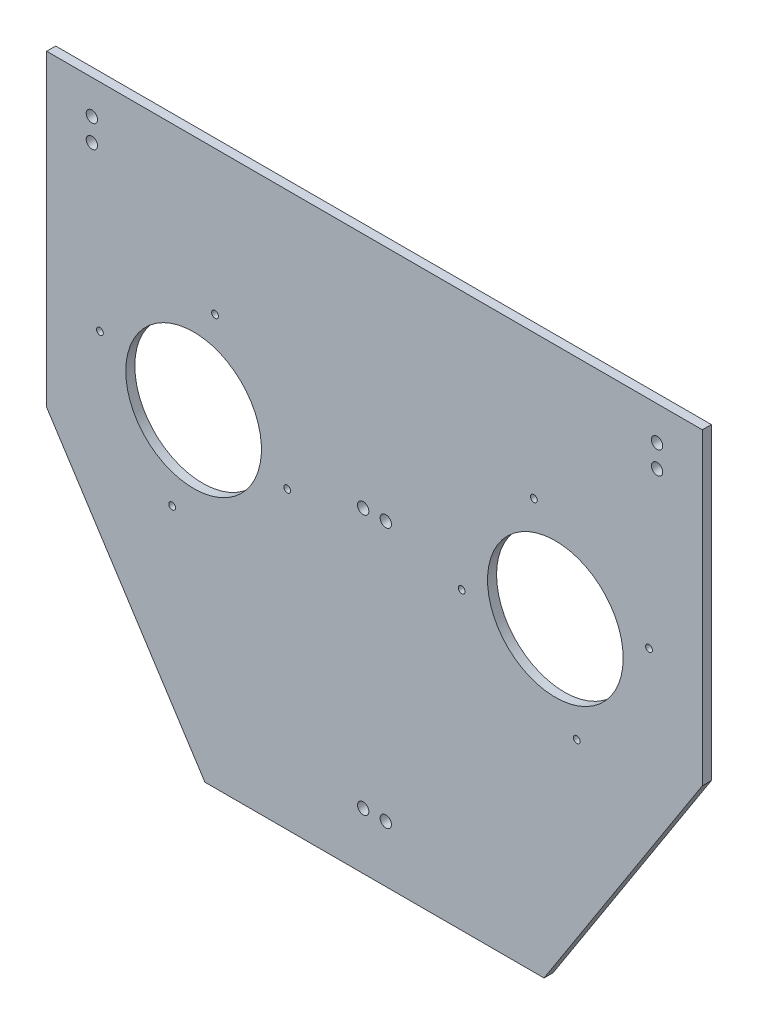
from build123d import *

# Parameters (mm, degrees)
SKETCH1_R           = 2.5
BOSS_EXTRUDE1_DEPTH = 4
SKETCH2_R           = 1.5
SKETCH2_R_2         = 30
SKETCH2_R_3         = 2.5
CUT_EXTRUDE1_DEPTH  = 10


with BuildPart() as part:
    # Sketch1 → Boss-Extrude1 (new body)
    with BuildSketch(Plane.XY):
        Polygon((-145, -16.387087703), (-75, -125), (75, -125), (145, -16.387087703), (145, 120), (-145, 120), align=None)
        with Locations((-125, 95)):
            Circle(SKETCH1_R, mode=Mode.SUBTRACT)
        with Locations((-125, 105)):
            Circle(SKETCH1_R, mode=Mode.SUBTRACT)
        with Locations((125, 95)):
            Circle(SKETCH1_R, mode=Mode.SUBTRACT)
        with Locations((125, 105)):
            Circle(SKETCH1_R, mode=Mode.SUBTRACT)
        with Locations((5, -100)):
            Circle(SKETCH1_R, mode=Mode.SUBTRACT)
        with Locations((-5, -100)):
            Circle(SKETCH1_R, mode=Mode.SUBTRACT)
    extrude(amount=BOSS_EXTRUDE1_DEPTH)

    # Sketch2 → Cut-Extrude1 (cut)
    with BuildSketch(Plane.XY.offset(4)):
        with Locations((38.573620895, 5.507628631)):
            Circle(SKETCH2_R)
        with Locations((70.507628631, 56.426379105)):
            Circle(SKETCH2_R)
        with Locations((121.426379105, 24.492371369)):
            Circle(SKETCH2_R)
        with Locations((89.492371369, -26.426379105)):
            Circle(SKETCH2_R)
        with Locations((80, 15)):
            Circle(SKETCH2_R_2)
        with Locations((-38.573620895, 5.507628631)):
            Circle(SKETCH2_R)
        with Locations((-70.507628631, 56.426379105)):
            Circle(SKETCH2_R)
        with Locations((-89.492371369, -26.426379105)):
            Circle(SKETCH2_R)
        with Locations((-121.426379105, 24.492371369)):
            Circle(SKETCH2_R)
        with Locations((-80, 15)):
            Circle(SKETCH2_R_2)
        with Locations((-5, 15)):
            Circle(SKETCH2_R_3)
        with Locations((5, 15)):
            Circle(SKETCH2_R_3)
    extrude(amount=-CUT_EXTRUDE1_DEPTH, mode=Mode.SUBTRACT)


solid = part.part
